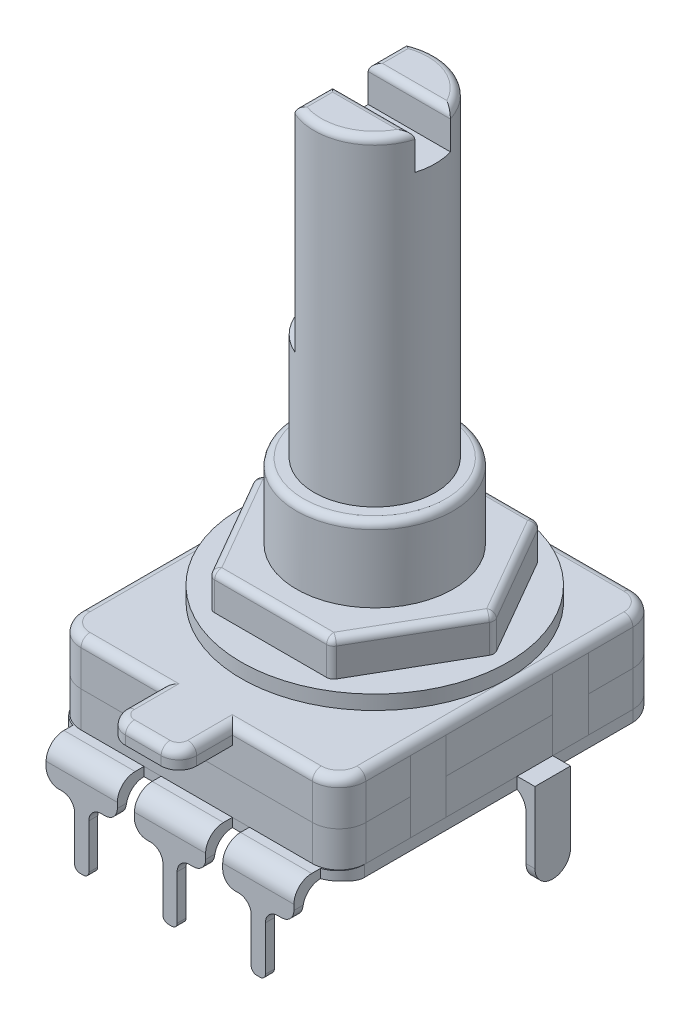
from build123d import *

# Parameters (mm, degrees)
EXTRUIR2_DEPTH    = 0.5
CROQUIS2_W        = 16
CROQUIS2_H        = 18
EXTRUIR4_DEPTH    = 2
CROQUIS4_W        = 16
CROQUIS4_H        = 18
EXTRUIR5_DEPTH    = 2.5
EXTRUIR6_DEPTH    = 1
CROQUIS7_W        = 0.5
CROQUIS7_H        = 2
EXTRUIR7_DEPTH    = 4.5
CROQUIS6_W        = 3
CROQUIS6_H        = 2
EXTRUIR8_DEPTH    = 0.5
CROQUIS8_W        = 0.5
CROQUIS8_H        = 2
EXTRUIR14_DEPTH   = 4
EXTRUIR14_2_DEPTH = 4
EXTRUIR14_3_DEPTH = 4
EXTRUIR14_4_DEPTH = 4
CROQUIS9_W        = 3
CROQUIS9_H        = 2
EXTRUIR16_DEPTH   = 0.5
EXTRUIR16_2_DEPTH = 0.5
EXTRUIR16_3_DEPTH = 0.5
EXTRUIR16_4_DEPTH = 0.5
EXTRUIR17_DEPTH   = 0.5
CROQUIS11_R       = 4.4
EXTRUIR20_DEPTH   = 7
CROQUIS12_R       = 3.4
EXTRUIR21_DEPTH   = 18
EXTRUIR22_DEPTH   = 12
EXTRUIR23_DEPTH   = 2
CROQUIS16_R       = 7.5
CROQUIS16_R_2     = 4.4
EXTRUIR24_DEPTH   = 0.8
CROQUIS17_R       = 4.4
EXTRUIR25_DEPTH   = 2
CROQUIS18_W       = 0.5
CROQUIS18_H       = 2
EXTRUIR26_DEPTH   = 4.5
REDONDEO1_R       = 1
REDONDEO2_R       = 1
REDONDEO3_R       = 1
REDONDEO4_R       = 1
REDONDEO5_R       = 1
REDONDEO6_R       = 1
REDONDEO7_R       = 1
REDONDEO8_R       = 1.5
REDONDEO9_R       = 1.5
REDONDEO10_R      = 1.5
REDONDEO11_R      = 1.5
REDONDEO12_R      = 1.5
REDONDEO13_R      = 1.5
REDONDEO14_R      = 1.5
REDONDEO15_R      = 1.5
REDONDEO16_R      = 1.5
REDONDEO17_R      = 1.5
REDONDEO18_R      = 1.5
REDONDEO19_R      = 1.5
REDONDEO20_R      = 0.4
REDONDEO21_R      = 0.4
REDONDEO22_R      = 0.4
REDONDEO23_R      = 0.4
REDONDEO24_R      = 0.5


# Some blends are built 0.0001 mm under size
with BuildPart() as part:
    # Croquis1 → Extruir2 (new body)
    with BuildSketch(Plane(origin=(0, 0, 0), x_dir=(1, 0, 0), z_dir=(0, 1, 0))):
        Polygon((6, -1), (10, -1), (10, 0), (10.96, 0), (10.96, -1), (14.96, -1), (14.96, 0), (16, 0), (16, 10), (17, 10), (17, 12), (16, 12), (16, 18), (0, 18), (0, 12), (-1, 12), (-1, 10), (0, 10), (0, 0), (1.04, 0), (1.04, -1), (5.04, -1), (5.04, 0), (6, 0), align=None)
    extrude(amount=EXTRUIR2_DEPTH)

    # Croquis10 → Extruir17 (add)
    with BuildSketch(Plane.XY.offset(1)):
        with BuildLine():
            Line((9.1, -1.5), (9.3, -1.5))
            ThreePointArc((9.3, -1.5), (9.794974747, -1.294974747), (10, -0.8))
            Line((10, -0.8), (10, 0.5))
            Line((10, 0.5), (6, 0.5))
            Line((6, 0.5), (6, -0.8))
            ThreePointArc((6, -0.8), (6.205025253, -1.294974747), (6.7, -1.5))
            Line((6.7, -1.5), (6.9, -1.5))
            ThreePointArc((6.9, -1.5), (7.394974747, -1.705025253), (7.6, -2.2))
            Line((7.6, -2.2), (7.6, -4.7))
            ThreePointArc((7.6, -4.7), (7.687867966, -4.912132034), (7.9, -5))
            Line((7.9, -5), (8.1, -5))
            ThreePointArc((8.1, -5), (8.312132034, -4.912132034), (8.4, -4.7))
            Line((8.4, -4.7), (8.4, -2.2))
            ThreePointArc((8.4, -2.2), (8.605025253, -1.705025253), (9.1, -1.5))
        make_face()
        with BuildLine():
            Line((14.06, -1.5), (14.26, -1.5))
            ThreePointArc((14.26, -1.5), (14.754974747, -1.294974747), (14.96, -0.8))
            Line((14.96, -0.8), (14.96, 0.5))
            Line((14.96, 0.5), (10.96, 0.5))
            Line((10.96, 0.5), (10.96, -0.8))
            ThreePointArc((10.96, -0.8), (11.165025253, -1.294974747), (11.66, -1.5))
            Line((11.66, -1.5), (11.86, -1.5))
            ThreePointArc((11.86, -1.5), (12.354974747, -1.705025253), (12.56, -2.2))
            Line((12.56, -2.2), (12.56, -4.7))
            ThreePointArc((12.56, -4.7), (12.647867966, -4.912132034), (12.86, -5))
            Line((12.86, -5), (13.06, -5))
            ThreePointArc((13.06, -5), (13.272132034, -4.912132034), (13.36, -4.7))
            Line((13.36, -4.7), (13.36, -2.2))
            ThreePointArc((13.36, -2.2), (13.565025253, -1.705025253), (14.06, -1.5))
        make_face()
        with BuildLine():
            Line((4.14, -1.5), (4.34, -1.5))
            ThreePointArc((4.34, -1.5), (4.834974747, -1.294974747), (5.04, -0.8))
            Line((5.04, -0.8), (5.04, 0.5))
            Line((5.04, 0.5), (1.04, 0.5))
            Line((1.04, 0.5), (1.04, -0.8))
            ThreePointArc((1.04, -0.8), (1.245025253, -1.294974747), (1.74, -1.5))
            Line((1.74, -1.5), (1.94, -1.5))
            ThreePointArc((1.94, -1.5), (2.434974747, -1.705025253), (2.64, -2.2))
            Line((2.64, -2.2), (2.64, -4.7))
            ThreePointArc((2.64, -4.7), (2.727867966, -4.912132034), (2.94, -5))
            Line((2.94, -5), (3.14, -5))
            ThreePointArc((3.14, -5), (3.352132034, -4.912132034), (3.44, -4.7))
            Line((3.44, -4.7), (3.44, -2.2))
            ThreePointArc((3.44, -2.2), (3.645025253, -1.705025253), (4.14, -1.5))
        make_face()
    extrude(amount=EXTRUIR17_DEPTH)

    # Croquis18 → Extruir26 (add)
    with BuildSketch(Plane.XZ):
        with Locations((-0.75, -11)):
            Rectangle(CROQUIS18_W, CROQUIS18_H)
        with Locations((16.75, -11)):
            Rectangle(CROQUIS18_W, CROQUIS18_H)
    extrude(amount=EXTRUIR26_DEPTH)

    # Redondeo1
    redondeo1_edges = [part.edges().sort_by_distance(p)[0] for p in [
        (8, 0.5, 1.5),
        (12.96, 0.5, 1.5),
        (3.04, 0.5, 1.5),
    ]]
    fillet(redondeo1_edges, radius=REDONDEO1_R)

    # Redondeo2
    redondeo2_edges = [part.edges().sort_by_distance(p)[0] for p in [
        (-1, 0.5, -11),
    ]]
    fillet(redondeo2_edges, radius=REDONDEO2_R)

    # Redondeo3
    redondeo3_edges = [part.edges().sort_by_distance(p)[0] for p in [
        (-0.5, 0, -11),
    ]]
    fillet(redondeo3_edges, radius=REDONDEO3_R)

    # Redondeo4
    redondeo4_edges = [part.edges().sort_by_distance(p)[0] for p in [
        (16.5, 0, -11),
    ]]
    fillet(redondeo4_edges, radius=REDONDEO4_R)

    # Redondeo5
    redondeo5_edges = [part.edges().sort_by_distance(p)[0] for p in [
        (12.96, 0, 1),
        (3.04, 0, 1),
        (8, 0, 1),
    ]]
    fillet(redondeo5_edges, radius=REDONDEO5_R)

    # Redondeo6
    redondeo6_edges = [part.edges().sort_by_distance(p)[0] for p in [
        (-0.75, -4.5, -12),
        (-0.75, -4.5, -10),
    ]]
    fillet(redondeo6_edges, radius=REDONDEO6_R - 0.0001)  # a hair under: the kernel refuses the full size

    # Redondeo7
    redondeo7_edges = [part.edges().sort_by_distance(p)[0] for p in [
        (16.75, -4.5, -12),
        (16.75, -4.5, -10),
    ]]
    fillet(redondeo7_edges, radius=REDONDEO7_R - 0.0001)  # a hair under: the kernel refuses the full size

    # Redondeo10
    # the kernel refuses this fillet: 1.5 mm, written as the material it takes off along each edge
    with BuildSketch(Plane(origin=(16, -3.703288256, 0), x_dir=(-1, 0, 0), z_dir=(0, 1, 0))) as redondeo10_piece_1:
        with BuildLine():
            CenterArc((1.5, -1.427725464), REDONDEO10_R, 107.858462698, 72.141537302)
            Line((0, -1.427725464), (-0.03, -1.427725464))
            Line((-0.03, -1.427725464), (-0.03, 0))
            Line((-0.03, 0), (0, 0.03))
            ThreePointArc((0, 0.03), (0.52, 0.03), (1.0308, 0.028554509))
            Line((1.0308, 0.028554509), (1.04, 0))
        make_face()
    extrude(amount=7.772601915, mode=Mode.SUBTRACT)

    # Redondeo13
    # the kernel refuses this fillet: 1.5 mm, written as the material it takes off along each edge
    with BuildSketch(Plane(origin=(0, -3.703288256, 0), x_dir=(1, 0, 0), z_dir=(0, 1, 0))) as redondeo13_piece_1:
        with BuildLine():
            CenterArc((1.5, 1.427725464), REDONDEO13_R, 180, 72.141537302)
            Line((0, 1.427725464), (-0.03, 1.427725464))
            Line((-0.03, 1.427725464), (-0.03, 0))
            Line((-0.03, 0), (0, -0.03))
            ThreePointArc((0, -0.03), (0.52, -0.03), (1.0308, -0.028554509))
            Line((1.0308, -0.028554509), (1.04, 0))
        make_face()
    extrude(amount=7.772601915, mode=Mode.SUBTRACT)

    # Redondeo16
    redondeo16_edges = [part.edges().sort_by_distance(p)[0] for p in [
        (0, 0.183012702, -18),
    ]]
    fillet(redondeo16_edges, radius=REDONDEO16_R)

    # Redondeo19
    redondeo19_edges = [part.edges().sort_by_distance(p)[0] for p in [
        (16, 0.183012702, -18),
    ]]
    fillet(redondeo19_edges, radius=REDONDEO19_R)


with BuildPart() as body_2:
    # Croquis2 → Extruir4 (new body)
    with BuildSketch(Plane(origin=(0, 0.5, 0), x_dir=(1, 0, 0), z_dir=(0, 1, 0))):
        with Locations((8, 9)):
            Rectangle(CROQUIS2_W, CROQUIS2_H)
    extrude(amount=EXTRUIR4_DEPTH)


with BuildPart() as body_3:
    # Croquis4 → Extruir5 (new body)
    with BuildSketch(Plane(origin=(0, 2.5, 0), x_dir=(1, 0, 0), z_dir=(0, 1, 0))):
        with Locations((8, 9)):
            Rectangle(CROQUIS4_W, CROQUIS4_H)
    extrude(amount=EXTRUIR5_DEPTH)

    # Croquis5 → Extruir6 (add)
    with BuildSketch(Plane(origin=(0, 5, 0), x_dir=(1, 0, 0), z_dir=(0, 1, 0))):
        with BuildLine():
            Line((6, 0), (10, 0))
            Line((10, 0), (10, -2))
            ThreePointArc((10, -2), (9.707106781, -2.707106781), (9, -3))
            Line((9, -3), (7, -3))
            ThreePointArc((7, -3), (6.292893219, -2.707106781), (6, -2))
            Line((6, -2), (6, 0))
        make_face()
    extrude(amount=-EXTRUIR6_DEPTH)


with BuildPart() as extruir7_tool:
    # Croquis7 → Extruir7 (new body)
    with BuildSketch(Plane(origin=(0, 5, 0), x_dir=(1, 0, 0), z_dir=(0, 1, 0))):
        with Locations((0.25, 13)):
            Rectangle(CROQUIS7_W, CROQUIS7_H)
        with Locations((15.75, 5)):
            Rectangle(CROQUIS7_W, CROQUIS7_H)
        with Locations((0.25, 5)):
            Rectangle(CROQUIS7_W, CROQUIS7_H)
        with Locations((15.75, 13)):
            Rectangle(CROQUIS7_W, CROQUIS7_H)
    extrude(amount=-EXTRUIR7_DEPTH)


with BuildPart() as body_2_1:
    add(body_2.part)

    # Extruir7: cut by extruir7_tool
    add(extruir7_tool.part, mode=Mode.SUBTRACT)

    # Redondeo9
    redondeo9_edges = [body_2_1.edges().sort_by_distance(p)[0] for p in [
        (16, 1.5, 0),
    ]]
    fillet(redondeo9_edges, radius=REDONDEO9_R)

    # Redondeo11
    redondeo11_edges = [body_2_1.edges().sort_by_distance(p)[0] for p in [
        (0, 1.5, 0),
    ]]
    fillet(redondeo11_edges, radius=REDONDEO11_R)

    # Redondeo15
    redondeo15_edges = [body_2_1.edges().sort_by_distance(p)[0] for p in [
        (0, 1.5, -18),
    ]]
    fillet(redondeo15_edges, radius=REDONDEO15_R)

    # Redondeo18
    redondeo18_edges = [body_2_1.edges().sort_by_distance(p)[0] for p in [
        (16, 1.5, -18),
    ]]
    fillet(redondeo18_edges, radius=REDONDEO18_R)


with BuildPart() as body_3_1:
    add(body_3.part)

    # Extruir7: cut by extruir7_tool
    add(extruir7_tool.part, mode=Mode.SUBTRACT)

    # Croquis6 → Extruir8 (cut)
    with BuildSketch(Plane(origin=(0, 5, 0), x_dir=(1, 0, 0), z_dir=(0, 1, 0))):
        with Locations((1.5, 13)):
            Rectangle(CROQUIS6_W, CROQUIS6_H)
        with Locations((14.5, 13)):
            Rectangle(CROQUIS6_W, CROQUIS6_H)
        with Locations((14.5, 5)):
            Rectangle(CROQUIS6_W, CROQUIS6_H)
        with Locations((1.5, 5)):
            Rectangle(CROQUIS6_W, CROQUIS6_H)
    extrude(amount=-EXTRUIR8_DEPTH, mode=Mode.SUBTRACT)

    # Croquis11 → Extruir20 (add)
    with BuildSketch(Plane(origin=(0, 5, 0), x_dir=(1, 0, 0), z_dir=(0, 1, 0))):
        with Locations(Location((8, 10, 0), (0, 0, 270))):
            Circle(CROQUIS11_R)
    extrude(amount=EXTRUIR20_DEPTH)

    # Croquis12 → Extruir21 (add)
    with BuildSketch(Plane(origin=(0, 12, 0), x_dir=(1, 0, 0), z_dir=(0, 1, 0))):
        with Locations(Location((8, 10, 0), (0, 0, 270))):
            Circle(CROQUIS12_R)
    extrude(amount=EXTRUIR21_DEPTH)

    # Croquis13 → Extruir22 (cut)
    with BuildSketch(Plane(origin=(0, 30, 0), x_dir=(1, 0, 0), z_dir=(0, 1, 0))):
        with BuildLine():
            Line((6.634474481, 13.113734102), (6.634474481, 6.886265898))
            ThreePointArc((6.634474481, 6.886265898), (4.6, 10), (6.634474481, 13.113734102))
        make_face()
    extrude(amount=-EXTRUIR22_DEPTH, mode=Mode.SUBTRACT)

    # Croquis14 → Extruir23 (cut)
    with BuildSketch(Plane(origin=(0, 30, 0), x_dir=(1, 0, 0), z_dir=(0, 1, 0))):
        with BuildLine():
            Line((6.634474481, 11), (6.634474481, 9))
            Line((6.634474481, 9), (11.249615362, 9))
            ThreePointArc((11.249615362, 9), (11.4, 10), (11.249615362, 11))
            Line((11.249615362, 11), (6.634474481, 11))
        make_face()
    extrude(amount=-EXTRUIR23_DEPTH, mode=Mode.SUBTRACT)



with BuildPart() as body_4:
    # Croquis8 → Extruir14 (new body)
    with BuildSketch(Plane(origin=(0, 0.5, 0), x_dir=(1, 0, 0), z_dir=(0, 1, 0))):
        with Locations((0.25, 13)):
            Rectangle(CROQUIS8_W, CROQUIS8_H)
    extrude(amount=EXTRUIR14_DEPTH)


with BuildPart() as body_5:
    # Croquis8 → Extruir14 2 (new body)
    with BuildSketch(Plane(origin=(0, 0.5, 0), x_dir=(1, 0, 0), z_dir=(0, 1, 0))):
        with Locations((15.75, 13)):
            Rectangle(CROQUIS8_W, CROQUIS8_H)
    extrude(amount=EXTRUIR14_2_DEPTH)


with BuildPart() as body_6:
    # Croquis8 → Extruir14 3 (new body)
    with BuildSketch(Plane(origin=(0, 0.5, 0), x_dir=(1, 0, 0), z_dir=(0, 1, 0))):
        with Locations((15.75, 5)):
            Rectangle(CROQUIS8_W, CROQUIS8_H)
    extrude(amount=EXTRUIR14_3_DEPTH)


with BuildPart() as body_7:
    # Croquis8 → Extruir14 4 (new body)
    with BuildSketch(Plane(origin=(0, 0.5, 0), x_dir=(1, 0, 0), z_dir=(0, 1, 0))):
        with Locations((0.25, 5)):
            Rectangle(CROQUIS8_W, CROQUIS8_H)
    extrude(amount=EXTRUIR14_4_DEPTH)


with BuildPart() as body_8:
    # Croquis9 → Extruir16 (new body)
    with BuildSketch(Plane(origin=(0, 4.5, 0), x_dir=(-1, 0, 0), z_dir=(0, 1, 0))):
        with Locations((-1.5, -13)):
            Rectangle(CROQUIS9_W, CROQUIS9_H)
    extrude(amount=EXTRUIR16_DEPTH)


with BuildPart() as body_9:
    # Croquis9 → Extruir16 2 (new body)
    with BuildSketch(Plane(origin=(0, 4.5, 0), x_dir=(-1, 0, 0), z_dir=(0, 1, 0))):
        with Locations((-14.5, -13)):
            Rectangle(CROQUIS9_W, CROQUIS9_H)
    extrude(amount=EXTRUIR16_2_DEPTH)


with BuildPart() as body_10:
    # Croquis9 → Extruir16 3 (new body)
    with BuildSketch(Plane(origin=(0, 4.5, 0), x_dir=(-1, 0, 0), z_dir=(0, 1, 0))):
        with Locations((-14.5, -5)):
            Rectangle(CROQUIS9_W, CROQUIS9_H)
    extrude(amount=EXTRUIR16_3_DEPTH)


with BuildPart() as body_11:
    # Croquis9 → Extruir16 4 (new body)
    with BuildSketch(Plane(origin=(0, 4.5, 0), x_dir=(-1, 0, 0), z_dir=(0, 1, 0))):
        with Locations((-1.5, -5)):
            Rectangle(CROQUIS9_W, CROQUIS9_H)
    extrude(amount=EXTRUIR16_4_DEPTH)


with BuildPart() as body_3_2:
    add(body_3_1.part)

    add(body_8.part)  # Extruir24 merges body 8

    add(body_9.part)  # Extruir24 merges body 9

    add(body_10.part)  # Extruir24 merges body 10

    add(body_11.part)  # Extruir24 merges body 11
    # Croquis16 → Extruir24 (add)
    with BuildSketch(Plane(origin=(0, 5, 0), x_dir=(1, 0, 0), z_dir=(0, 1, 0))):
        with Locations(Location((8, 10, 0), (0, 0, 270))):
            Circle(CROQUIS16_R)
        with Locations(Location((8, 10, 0), (0, 0, 270))):
            Circle(CROQUIS16_R_2, mode=Mode.SUBTRACT)
    extrude(amount=EXTRUIR24_DEPTH)

    # Croquis17 → Extruir25 (add)
    with BuildSketch(Plane(origin=(0, 5.8, 0), x_dir=(1, 0, 0), z_dir=(0, 1, 0))):
        Polygon((1.25, 10), (4.625, 15.845671476), (11.375, 15.845671476), (14.75, 10), (11.375, 4.154328524), (4.625, 4.154328524), align=None)
        with Locations(Location((8, 10, 0), (0, 0, 90))):
            Circle(CROQUIS17_R, mode=Mode.SUBTRACT)
    extrude(amount=EXTRUIR25_DEPTH)

    # Redondeo8
    redondeo8_edges = [body_3_2.edges().sort_by_distance(p)[0] for p in [
        (16, 3.75, 0),
    ]]
    fillet(redondeo8_edges, radius=REDONDEO8_R)

    # Redondeo12
    redondeo12_edges = [body_3_2.edges().sort_by_distance(p)[0] for p in [
        (0, 3.75, 0),
    ]]
    fillet(redondeo12_edges, radius=REDONDEO12_R)

    # Redondeo14
    redondeo14_edges = [body_3_2.edges().sort_by_distance(p)[0] for p in [
        (0, 3.75, -18),
    ]]
    fillet(redondeo14_edges, radius=REDONDEO14_R)

    # Redondeo17
    redondeo17_edges = [body_3_2.edges().sort_by_distance(p)[0] for p in [
        (16, 3.75, -18),
    ]]
    fillet(redondeo17_edges, radius=REDONDEO17_R)

    # Redondeo20
    redondeo20_edges = [body_3_2.edges().sort_by_distance(p)[0] for p in [
        (8, 7.8, -15.845671476),
        (2.9375, 7.8, -12.922835738),
        (2.9375, 7.8, -7.077164262),
        (8, 7.8, -4.154328524),
        (13.0625, 7.8, -7.077164262),
        (13.0625, 7.8, -12.922835738),
        (11.375, 6.8, -15.845671476),
        (4.625, 6.8, -15.845671476),
        (1.25, 6.8, -10),
        (4.625, 6.8, -4.154328524),
        (11.375, 6.8, -4.154328524),
        (14.75, 6.8, -10),
    ]]
    fillet(redondeo20_edges, radius=REDONDEO20_R)

    # Redondeo21
    redondeo21_edges = [body_3_2.edges().sort_by_distance(p)[0] for p in [
        (8, 12, -14.4),
    ]]
    fillet(redondeo21_edges, radius=REDONDEO21_R)

    # Redondeo22
    redondeo22_edges = [body_3_2.edges().sort_by_distance(p)[0] for p in [
        (10.019900988, 30, -7.265041134),
        (6.634474481, 30, -7.943132949),
        (8.942044921, 30, -9),
    ]]
    fillet(redondeo22_edges, radius=REDONDEO22_R)

    # Redondeo23
    redondeo23_edges = [body_3_2.edges().sort_by_distance(p)[0] for p in [
        (9.415774204, 30, -13.091210669),
        (6.634474481, 30, -12.056867051),
        (8.942044921, 30, -11),
    ]]
    fillet(redondeo23_edges, radius=REDONDEO23_R)

    # Redondeo24
    redondeo24_edges = [body_3_2.edges().sort_by_distance(p)[0] for p in [
        (16, 5, -9),
        (15.560660172, 5, -0.439339828),
        (3.75, 5, 0),
        (0.439339828, 5, -0.439339828),
        (0, 5, -9),
        (0.439339828, 5, -17.560660172),
        (8, 5, -18),
        (15.560660172, 5, -17.560660172),
        (6, 5, 1),
        (6.292893219, 5, 2.707106781),
        (8, 5, 3),
        (9.707106781, 5, 2.707106781),
        (10, 5, 1),
        (12.25, 5, 0),
    ]]
    fillet(redondeo24_edges, radius=REDONDEO24_R - 0.0001)  # a hair under: the kernel refuses the full size


solid = Compound([part.part, body_2_1.part, body_4.part, body_5.part, body_6.part, body_7.part, body_3_2.part])
